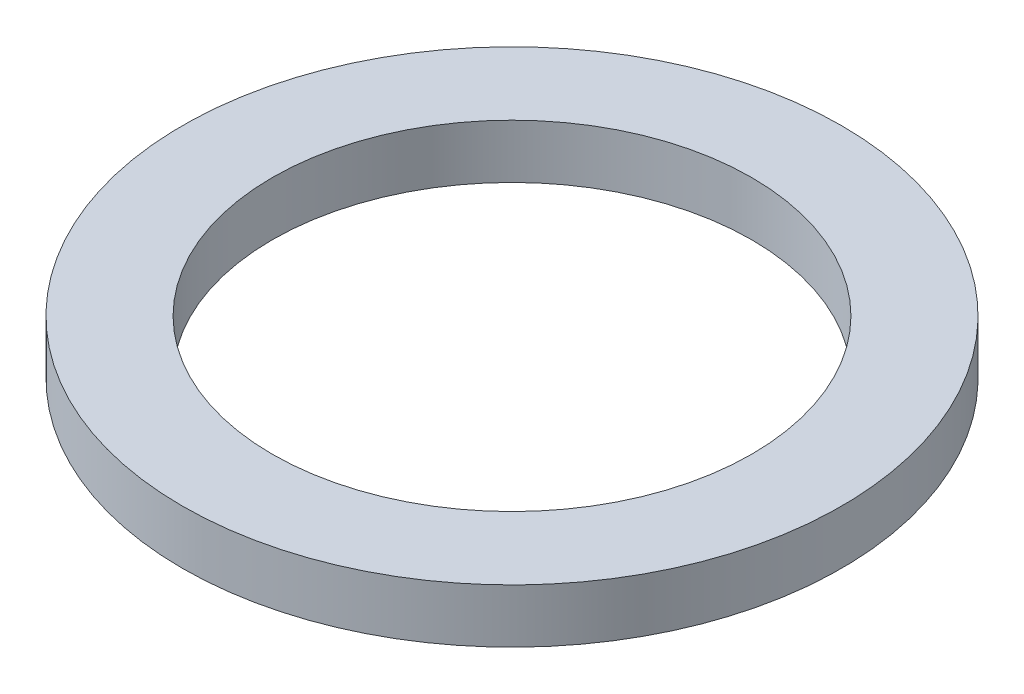
from build123d import *

# Parameters (mm, degrees)
SKETCH1_R           = 55
BOSS_EXTRUDE1_DEPTH = 9
SKETCH2_R           = 40
CUT_EXTRUDE1_DEPTH  = 79.300702423


with BuildPart() as part:
    # Sketch1 → Boss-Extrude1 (new body)
    with BuildSketch(Plane(origin=(0, 0, 0), x_dir=(1, 0, 0), z_dir=(0, 1, 0))):
        Circle(SKETCH1_R)
    extrude(amount=BOSS_EXTRUDE1_DEPTH)

    # Sketch2 → Cut-Extrude1 (cut, through all)
    with BuildSketch(Plane(origin=(0, 0, 0), x_dir=(1, 0, 0), z_dir=(0, 1, 0))):
        Circle(SKETCH2_R)
    extrude(amount=CUT_EXTRUDE1_DEPTH, mode=Mode.SUBTRACT)


solid = part.part
